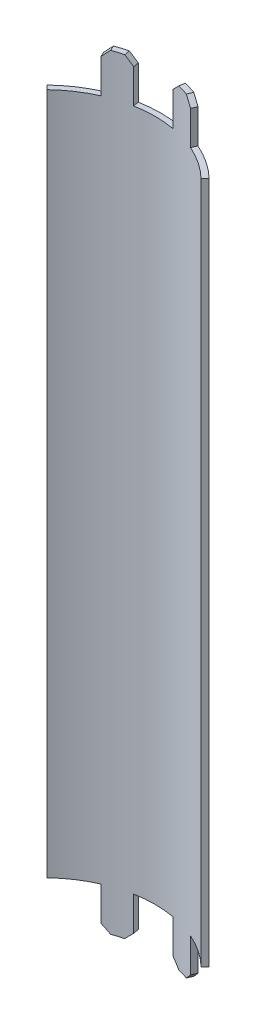
from build123d import *
from build123d.topology import SkipClean

# Parameters (mm, degrees)
BASE_FLANGE1_DEPTH = 101.5
SKETCH6_OUTSIDE_W  = 86.526
SKETCH6_OUTSIDE_H  = 53.285
EXTRUDE1_DEPTH     = 11
CHAMFER1_SIZE      = 2


# Sheet-metal steps are written as plain solids
with BuildPart() as part:
    # Sketch1 → Base-Flange1 (new, symmetric)
    with BuildSketch(Plane(origin=(0, 0, 0), x_dir=(1, 0, 0), z_dir=(0, 1, 0))):
        with BuildLine():
            ThreePointArc((20.45, 21.261409), (0, 29.5), (-20.45, 21.261409))
            Line((-20.45, 21.261409), (-21.489831, 22.342497))
            ThreePointArc((-21.489831, 22.342497), (0, 31), (21.489831, 22.342497))
            Line((21.489831, 22.342497), (20.45, 21.261409))
        make_face()
    extrude(amount=BASE_FLANGE1_DEPTH, both=True)

    # Sketch6 outside → Extrude1 (cut)
    with SkipClean():  # the faces are left unmerged after this step: merging them gives an invalid solid
        with BuildSketch(Plane(origin=(0, 101.5, 0), x_dir=(1, 0, 0), z_dir=(0, 1, 0))):
            with Locations((0, 26.1305)):
                Rectangle(SKETCH6_OUTSIDE_W, SKETCH6_OUTSIDE_H)
            with BuildLine():
                Line((-12.500176, 28.368038), (-11.895329, 26.995391))
                ThreePointArc((-11.895329, 26.995391), (-8.608467, 28.216029), (-5.2, 29.038078))
                Line((-5.2, 29.038078), (-5.464407, 30.514591))
                ThreePointArc((-5.464407, 30.514591), (-9.046186, 29.650742), (-12.500176, 28.368038))
            make_face(mode=Mode.SUBTRACT)
            with BuildLine():
                Line((5.464407, 30.514591), (5.2, 29.038078))
                ThreePointArc((5.2, 29.038078), (8.608467, 28.216029), (11.895329, 26.995391))
                Line((11.895329, 26.995391), (12.500176, 28.368038))
                ThreePointArc((12.500176, 28.368038), (9.046186, 29.650742), (5.464407, 30.514591))
            make_face(mode=Mode.SUBTRACT)
        extrude1 = extrude(amount=-EXTRUDE1_DEPTH, mode=Mode.SUBTRACT)

    # Mirror1: Extrude1 across plane
    with SkipClean():  # the faces are left unmerged after this step: merging them gives an invalid solid
        add(extrude1.mirror(Plane.ZX), mode=Mode.SUBTRACT)

    # Chamfer1
    chamfer1_edges = [part.edges().sort_by_distance(p)[0] for p in [
        (12.197753, 101.5, -27.681715),
        (-12.197753, 101.5, -27.681715),
        (-5.332203, 101.5, -29.776335),
        (5.332203, 101.5, -29.776335),
        (-5.332203, -101.5, -29.776335),
        (5.332203, -101.5, -29.776335),
        (-12.197753, -101.5, -27.681715),
        (12.197753, -101.5, -27.681715),
    ]]
    chamfer(chamfer1_edges, length=CHAMFER1_SIZE)


solid = part.part
